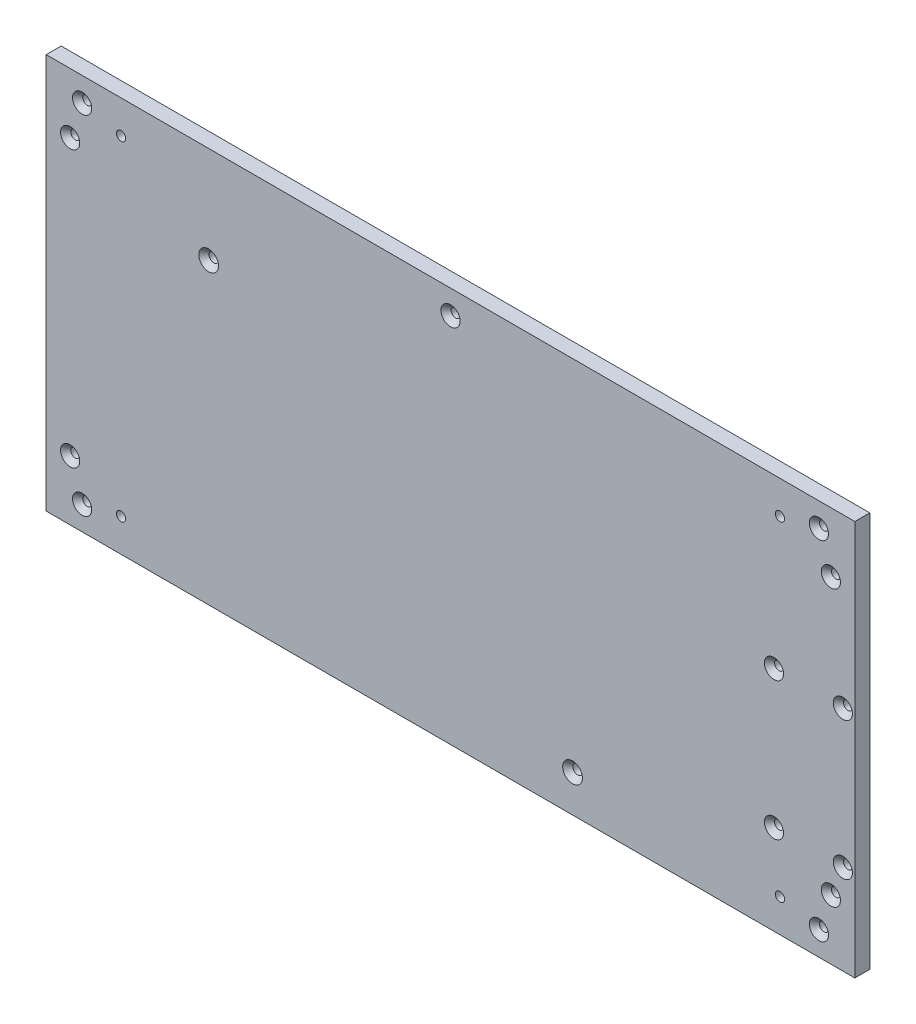
from build123d import *

# Parameters (mm, degrees)
SKETCH1_W            = 270
SKETCH1_H            = 132
BASE_DEPTH           = 2.5
SKETCH2_R            = 1.5
FASTENERSHOLES_DEPTH = 151.352918163
SKETCH3_R            = 1.6
PSUMOUNT_DEPTH       = 151.352918163
SKETCH4_R            = 1.5
INTERFACEHOLES_DEPTH = 151.352918163
CHAMFERALL_SIZE      = 1.7
SKETCH5_R            = 1.55
CUT_EXTRUDE2_DEPTH   = 151.352918163


with BuildPart() as part:
    # Sketch1 → Base (new, symmetric)
    with BuildSketch(Plane.XY):
        Rectangle(SKETCH1_W, SKETCH1_H)
    extrude(amount=BASE_DEPTH, both=True)

    # Sketch2 → FastenersHoles (cut, through all)
    with BuildSketch(Plane.XY.offset(2.5)):
        with Locations((-127, -46)):
            Circle(SKETCH2_R)
        with Locations((-123, -58)):
            Circle(SKETCH2_R)
        with Locations((-127, 46)):
            Circle(SKETCH2_R)
        with Locations((-123, 58)):
            Circle(SKETCH2_R)
        with Locations((0, 58)):
            Circle(SKETCH2_R)
        with Locations((123, -58)):
            Circle(SKETCH2_R)
        with Locations((127, -46)):
            Circle(SKETCH2_R)
        with Locations((127, 46)):
            Circle(SKETCH2_R)
        with Locations((123, 58)):
            Circle(SKETCH2_R)
    extrude(amount=-FASTENERSHOLES_DEPTH, mode=Mode.SUBTRACT)

    # Sketch3 → PSUMount (cut, through all)
    with BuildSketch(Plane(origin=(0, 0, -2.5), x_dir=(-1, 0, 0), z_dir=(0, 0, -1))):
        with Locations((-40.75, -53.65)):
            Circle(SKETCH3_R)
        with Locations((80.75, 33.65)):
            Circle(SKETCH3_R)
    extrude(amount=-PSUMOUNT_DEPTH, mode=Mode.SUBTRACT)

    # Sketch4 → InterfaceHoles (cut, through all)
    with BuildSketch(Plane.XY.offset(2.5)):
        with Locations((108, 10)):
            Circle(SKETCH4_R)
        with Locations((131, 10)):
            Circle(SKETCH4_R)
        with Locations((108, -36)):
            Circle(SKETCH4_R)
        with Locations((131, -36)):
            Circle(SKETCH4_R)
    extrude(amount=-INTERFACEHOLES_DEPTH, mode=Mode.SUBTRACT)

    # ChamferAll
    chamferall_edges = [part.edges().sort_by_distance(p)[0] for p in [
        (42.35, -53.65, 2.5),
        (-124.5, -58, 2.5),
        (-128.5, -46, 2.5),
        (-124.5, 58, 2.5),
        (-128.5, 46, 2.5),
        (-79.15, 33.65, 2.5),
        (-1.5, 58, 2.5),
        (121.5, 58, 2.5),
        (125.5, 46, 2.5),
        (125.5, -46, 2.5),
        (121.5, -58, 2.5),
        (129.5, 10, 2.5),
        (129.5, -36, 2.5),
        (106.5, -36, 2.5),
        (106.5, 10, 2.5),
    ]]
    chamfer(chamferall_edges, length=CHAMFERALL_SIZE)

    # Sketch5 → Cut-Extrude2 (cut, through all)
    with BuildSketch(Plane.XY.offset(2.5)):
        with Locations((-110, -55)):
            Circle(SKETCH5_R)
        with Locations((-110, 55)):
            Circle(SKETCH5_R)
        with Locations((110, 55)):
            Circle(SKETCH5_R)
        with Locations((110, -55)):
            Circle(SKETCH5_R)
    extrude(amount=-CUT_EXTRUDE2_DEPTH, mode=Mode.SUBTRACT)


solid = part.part
